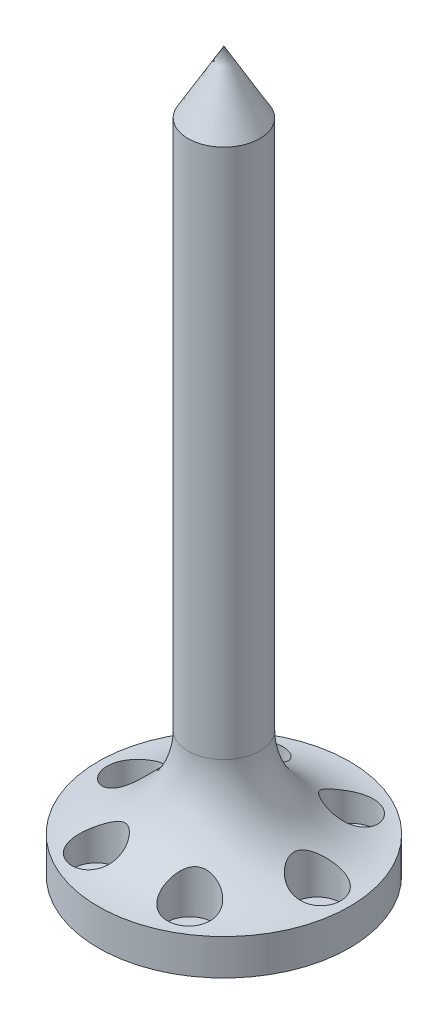
from build123d import *

# Parameters (mm, degrees)
CBORE_START                                   = 1.6
CBORE_FOR_M3_HEX_SOCKET_HEAD_CAP_SCR_2_R      = 3.25
CBORE_FOR_M3_HEX_SOCKET_HEAD_CAP_SCREW1_DEPTH = 6.092474541
CBORE_FOR_M3_HEX_SOCKET_HEAD_CAP_SCR_3_O_R    = 1.7
CBORE_FOR_M3_HEX_SOCKET_HEAD_CAP_SCR_3_DEPTH  = 1.6


with BuildPart() as part:
    # Sketch1 → Revolve1 (revolve)
    with BuildSketch(Plane.XY, mode=Mode.PRIVATE) as revolve1_sk:
        with BuildLine():
            Line((0, 0), (17.5, 0))
            Line((17.5, 0), (17.5, 5))
            ThreePointArc((17.5, 5), (8.661165235, 8.661165235), (5, 17.5))
            Line((5, 17.5), (5, 91.339745962))
            Line((5, 91.339745962), (0, 100))
            Line((0, 100), (0, 0))
        make_face()
    revolve(revolve1_sk.sketch.rotate(Axis((0, 0, 0), (0, 1, 0)), 90), axis=Axis((0, 0, 0), (0, 1, 0)))

    # CBORE for M3 Hex Socket Head Cap Screw1: read off the stored shape, not the designer's step
    # CBORE for M3 Hex Socket Head Cap Scr 2 → CBORE for M3 Hex Socket Head Cap Screw1 (cut)
    with BuildSketch(Plane(origin=(0, 0, 0), x_dir=(1, 0, 0), z_dir=(0, 1, 0)).offset(CBORE_START)):
        with Locations((-6.5, -11.258330249)):
            Circle(CBORE_FOR_M3_HEX_SOCKET_HEAD_CAP_SCR_2_R)
        with Locations((6.5, -11.258330249)):
            Circle(CBORE_FOR_M3_HEX_SOCKET_HEAD_CAP_SCR_2_R)
        with Locations((13, 0)):
            Circle(CBORE_FOR_M3_HEX_SOCKET_HEAD_CAP_SCR_2_R)
        with Locations((6.5, 11.258330249)):
            Circle(CBORE_FOR_M3_HEX_SOCKET_HEAD_CAP_SCR_2_R)
        with Locations((-6.5, 11.258330249)):
            Circle(CBORE_FOR_M3_HEX_SOCKET_HEAD_CAP_SCR_2_R)
        with Locations((-13, 0)):
            Circle(CBORE_FOR_M3_HEX_SOCKET_HEAD_CAP_SCR_2_R)
    extrude(amount=CBORE_FOR_M3_HEX_SOCKET_HEAD_CAP_SCREW1_DEPTH, mode=Mode.SUBTRACT)

    # CBORE for M3 Hex Socket Head Cap Scr 3 o → CBORE for M3 Hex Socket Head Cap Scr 3 (cut)
    with BuildSketch(Plane(origin=(0, 0, 0), x_dir=(1, 0, 0), z_dir=(0, 1, 0))):
        with Locations((-6.5, -11.258330249)):
            Circle(CBORE_FOR_M3_HEX_SOCKET_HEAD_CAP_SCR_3_O_R)
        with Locations((6.5, -11.258330249)):
            Circle(CBORE_FOR_M3_HEX_SOCKET_HEAD_CAP_SCR_3_O_R)
        with Locations((13, 0)):
            Circle(CBORE_FOR_M3_HEX_SOCKET_HEAD_CAP_SCR_3_O_R)
        with Locations((6.5, 11.258330249)):
            Circle(CBORE_FOR_M3_HEX_SOCKET_HEAD_CAP_SCR_3_O_R)
        with Locations((-6.5, 11.258330249)):
            Circle(CBORE_FOR_M3_HEX_SOCKET_HEAD_CAP_SCR_3_O_R)
        with Locations((-13, 0)):
            Circle(CBORE_FOR_M3_HEX_SOCKET_HEAD_CAP_SCR_3_O_R)
    extrude(amount=CBORE_FOR_M3_HEX_SOCKET_HEAD_CAP_SCR_3_DEPTH, mode=Mode.SUBTRACT)


solid = part.part
